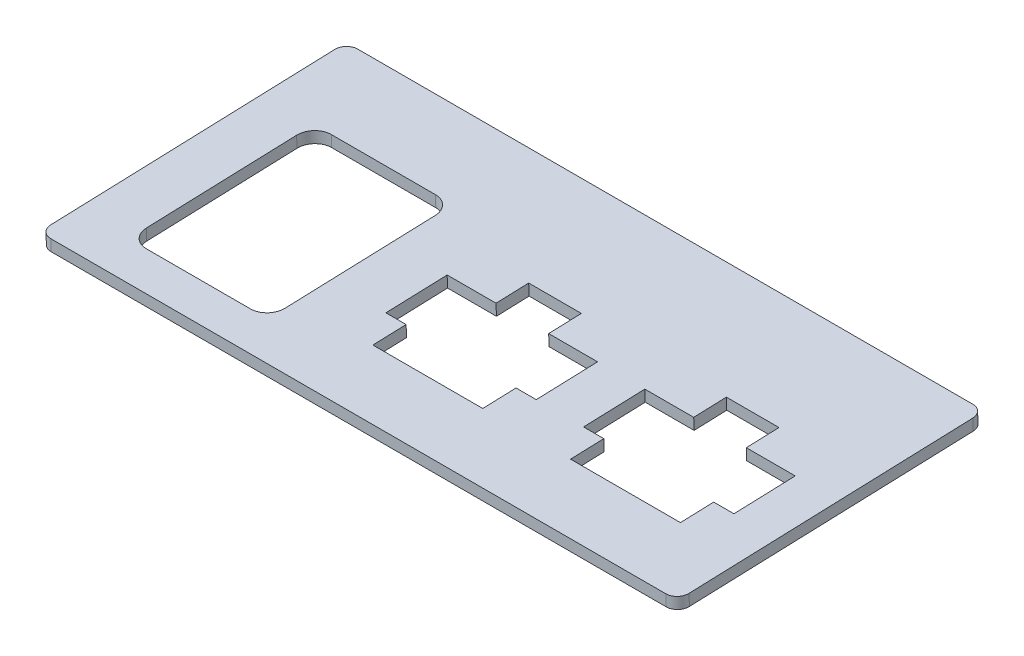
from build123d import *

# Parameters (mm, degrees)
SKETCH1_W           = 110.35
SKETCH1_H           = 53.101321069
BOSS_EXTRUDE1_DEPTH = 2
CUT_EXTRUDE1_REACH  = 75.729
FILLET1_R           = 2


with BuildPart() as part:
    # Sketch1 → Boss-Extrude1 (new body)
    with BuildSketch(Plane(origin=(0, -68.990841945, -2.409213289), x_dir=(1, 0, 0), z_dir=(0, 0.9993908270190958, 0.03489949670250105))):
        with Locations((0, 22.243763745)):
            Rectangle(SKETCH1_W, SKETCH1_H)
    extrude(amount=BOSS_EXTRUDE1_DEPTH)

    # Sketch2 → Cut-Extrude1 (cut, up to next)
    with BuildSketch(Plane(origin=(0, -68.990841945, -2.409213289), x_dir=(1, 0, 0), z_dir=(0, -0.9993908270190958, -0.03489949670250106)), mode=Mode.PRIVATE) as cut_extrude1_sk1:
        Polygon((-4.05, -23.568778974), (-4.05, -29.218778974), (5.05, -29.218778974), (5.05, -23.568778974), (13.5, -23.568778974), (13.5, -12.968778974), (10, -12.968778974), (10, -7.218778974), (-9, -7.218778974), (-9, -12.968778974), (-12.5, -12.968778974), (-12.5, -23.568778974), align=None)
    cut_extrude1_tool1 = extrude(cut_extrude1_sk1.sketch, amount=-CUT_EXTRUDE1_REACH, mode=Mode.PRIVATE) & part.part
    # Sketch2 → Cut-Extrude1 (cut, up to next)
    with BuildSketch(Plane(origin=(0, -68.990841945, -2.409213289), x_dir=(1, 0, 0), z_dir=(0, -0.9993908270190958, -0.03489949670250106)), mode=Mode.PRIVATE) as cut_extrude1_sk2:
        with BuildLine():
            Line((-43.175, -2.218778974), (-25.175, -2.218778974))
            ThreePointArc((-25.175, -2.218778974), (-23.053679656, -3.09745863), (-22.175, -5.218778974))
            Line((-22.175, -5.218778974), (-22.175, -31.218778974))
            ThreePointArc((-22.175, -31.218778974), (-23.053679656, -33.340099317), (-25.175, -34.218778974))
            Line((-25.175, -34.218778974), (-43.175, -34.218778974))
            ThreePointArc((-43.175, -34.218778974), (-45.296320344, -33.340099317), (-46.175, -31.218778974))
            Line((-46.175, -31.218778974), (-46.175, -5.218778974))
            ThreePointArc((-46.175, -5.218778974), (-45.296320344, -3.09745863), (-43.175, -2.218778974))
        make_face()
    cut_extrude1_tool2 = extrude(cut_extrude1_sk2.sketch, amount=-CUT_EXTRUDE1_REACH, mode=Mode.PRIVATE) & part.part
    # Sketch2 → Cut-Extrude1 (cut, up to next)
    with BuildSketch(Plane(origin=(0, -68.990841945, -2.409213289), x_dir=(1, 0, 0), z_dir=(0, -0.9993908270190958, -0.03489949670250106)), mode=Mode.PRIVATE) as cut_extrude1_sk3:
        Polygon((30.125, -23.568778974), (21.675, -23.568778974), (21.675, -12.968778974), (25.175, -12.968778974), (25.175, -7.218778974), (44.175, -7.218778974), (44.175, -12.968778974), (47.675, -12.968778974), (47.675, -23.568778974), (39.225, -23.568778974), (39.225, -29.218778974), (30.125, -29.218778974), align=None)
    cut_extrude1_tool3 = extrude(cut_extrude1_sk3.sketch, amount=-CUT_EXTRUDE1_REACH, mode=Mode.PRIVATE) & part.part
    add(cut_extrude1_tool1.solids().sort_by_distance((0.5, -68.391299, -19.577887))[0], mode=Mode.SUBTRACT)
    add(cut_extrude1_tool2.solids().sort_by_distance((-34.175, -68.355016, -20.616894))[0], mode=Mode.SUBTRACT)
    add(cut_extrude1_tool3.solids().sort_by_distance((34.675, -68.391299, -19.577887))[0], mode=Mode.SUBTRACT)

    # Fillet1
    fillet1_edges = [part.edges().sort_by_distance(p)[0] for p in [
        (-55.175, -68.141759648, 1.929959353),
        (55.175, -68.141759648, 1.929959353),
        (55.175, -66.288550269, -51.139013826),
        (-55.175, -66.288550269, -51.139013826),
    ]]
    fillet(fillet1_edges, radius=FILLET1_R)


solid = part.part
